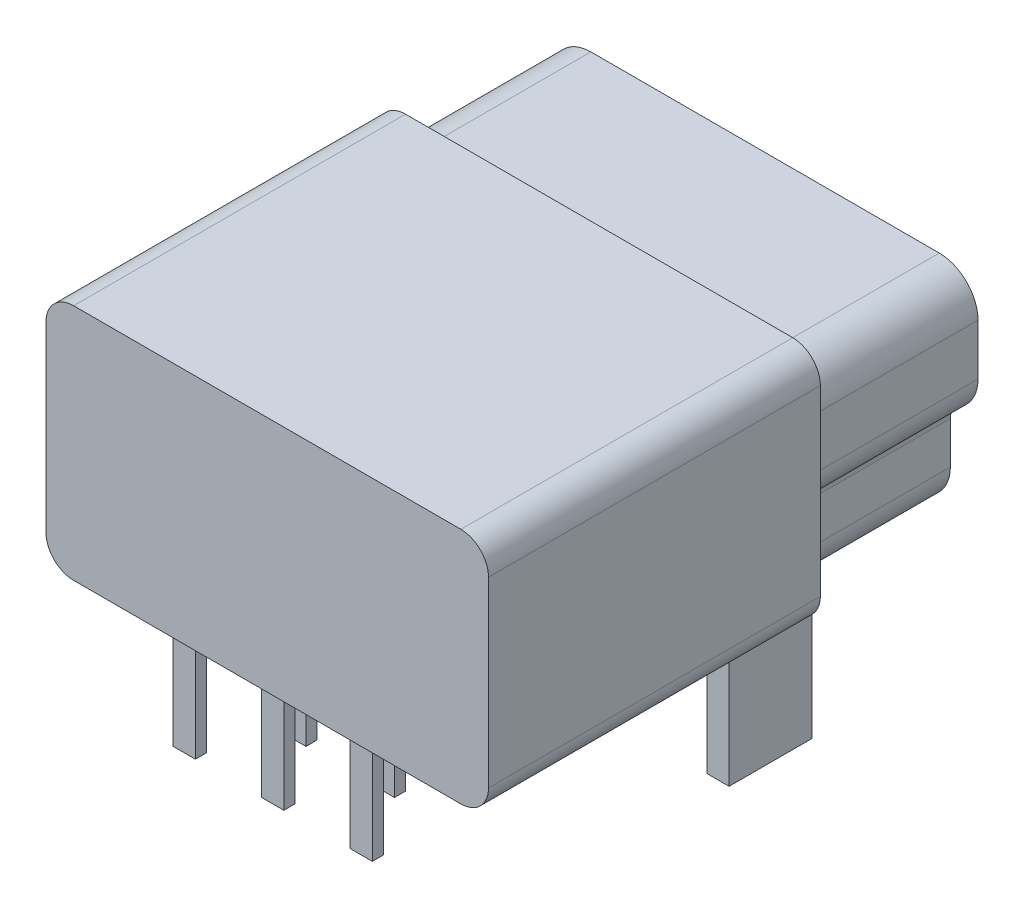
from build123d import *

# Parameters (mm, degrees)
ESQUISSE1_W             = 8
ESQUISSE1_H             = 4.3
EXTRUSION1_DEPTH        = 9
ESQUISSE2_W             = 6
ESQUISSE2_H             = 3.3
ENL_V_MAT_EXTRU_1_DEPTH = 4
ESQUISSE3_W             = 0.4
ESQUISSE3_H             = 1.5
EXTRUSION2_DEPTH        = 1.8
CONG_1_R                = 0.5
ESQUISSE4_W             = 0.4
ESQUISSE4_H             = 0.2
EXTRUSION3_DEPTH        = 1.8
ENL_V_START             = -3
ENL_V_MAT_EXTRU_3_DEPTH = 3


# Read off the part's stored shape, not the designer's step: Enlèv. mat.-Extru.3
with BuildPart() as part:
    # Esquisse1 → Extrusion1 (new body)
    with BuildSketch(Plane.XY):
        with Locations((-4, 2.15)):
            Rectangle(ESQUISSE1_W, ESQUISSE1_H)
    extrude(amount=EXTRUSION1_DEPTH)

    # Esquisse2 → Enlèv. mat.-Extru.1 (cut)
    with BuildSketch(Plane(origin=(0, 0, 0), x_dir=(-1, 0, 0), z_dir=(0, 0, -1))):
        with Locations((4, 2.15)):
            Rectangle(ESQUISSE2_W, ESQUISSE2_H)
    extrude(amount=-ENL_V_MAT_EXTRU_1_DEPTH, mode=Mode.SUBTRACT)

    # Esquisse3 → Extrusion2 (add)
    with BuildSketch(Plane.XZ):
        with Locations((-0.35, 3.75)):
            Rectangle(ESQUISSE3_W, ESQUISSE3_H)
        with Locations((-7.65, 3.75)):
            Rectangle(ESQUISSE3_W, ESQUISSE3_H)
    extrude(amount=EXTRUSION2_DEPTH)

    # Congé1
    # the kernel refuses this fillet: 0.5 mm, written as the material it takes off along each edge
    with BuildSketch(Plane(origin=(0, 0, -1.25), x_dir=(-1, 0, 0), z_dir=(0, 0, 1))) as cong_1_piece_1_section:
        with BuildLine():
            CenterArc((CONG_1_R, -CONG_1_R), CONG_1_R, 90, 90)
            Line((0, -CONG_1_R), (0, 0))
            Line((0, 0), (CONG_1_R, 0))
        make_face()
    cong_1_piece_1 = extrude(amount=11.5, mode=Mode.PRIVATE)
    cong_1_piece_1 = split(cong_1_piece_1, bisect_by=Plane(origin=(-0.251340373, 0.033035409, 3), z_dir=(0, 0, -1)), keep=Keep.TOP, mode=Mode.PRIVATE)
    cong_1_piece_1 = split(cong_1_piece_1, bisect_by=Plane(origin=(-0.15, 0.033035409, 0.875), z_dir=(-1, 0, 0)), keep=Keep.TOP, mode=Mode.PRIVATE)
    add(cong_1_piece_1, mode=Mode.SUBTRACT)
    with BuildSketch(Plane(origin=(0, 0, -1.25), x_dir=(-1, 0, 0), z_dir=(0, 0, 1))) as cong_1_piece_2_section:
        with BuildLine():
            CenterArc((CONG_1_R, -CONG_1_R), CONG_1_R, 90, 90)
            Line((0, -CONG_1_R), (0, 0))
            Line((0, 0), (CONG_1_R, 0))
        make_face()
    cong_1_piece_2 = extrude(amount=11.5, mode=Mode.PRIVATE)
    cong_1_piece_2 = split(cong_1_piece_2, bisect_by=Plane(origin=(-0.054158411, 0.147457064, 3), z_dir=(0, 0, -1)), keep=Keep.TOP, mode=Mode.PRIVATE)
    cong_1_piece_2 = split(cong_1_piece_2, bisect_by=Plane(origin=(-0.15, 0.147457064, 0.875), z_dir=(1, 0, 0)), keep=Keep.TOP, mode=Mode.PRIVATE)
    add(cong_1_piece_2, mode=Mode.SUBTRACT)
    with BuildSketch(Plane(origin=(0, 0, -1.25), x_dir=(-1, 0, 0), z_dir=(0, 0, 1))) as cong_1_piece_3_section:
        with BuildLine():
            CenterArc((CONG_1_R, -CONG_1_R), CONG_1_R, 90, 90)
            Line((0, -CONG_1_R), (0, 0))
            Line((0, 0), (CONG_1_R, 0))
        make_face()
    cong_1_piece_3 = extrude(amount=11.5, mode=Mode.PRIVATE)
    cong_1_piece_3 = split(cong_1_piece_3, bisect_by=Plane(origin=(-0.054158411, 0.147457064, 3), z_dir=(0, 0, 1)), keep=Keep.TOP, mode=Mode.PRIVATE)
    cong_1_piece_3 = split(cong_1_piece_3, bisect_by=Plane(origin=(-0.15, 0.147457064, 3.75), z_dir=(1, 0, 0)), keep=Keep.TOP, mode=Mode.PRIVATE)
    cong_1_piece_3 = split(cong_1_piece_3, bisect_by=Plane(origin=(-0.054158411, 0.147457064, 4.5), z_dir=(0, 0, -1)), keep=Keep.TOP, mode=Mode.PRIVATE)
    add(cong_1_piece_3, mode=Mode.SUBTRACT)
    with BuildSketch(Plane(origin=(0, 0, -1.25), x_dir=(-1, 0, 0), z_dir=(0, 0, 1))) as cong_1_piece_4_section:
        with BuildLine():
            CenterArc((CONG_1_R, -CONG_1_R), CONG_1_R, 90, 90)
            Line((0, -CONG_1_R), (0, 0))
            Line((0, 0), (CONG_1_R, 0))
        make_face()
    cong_1_piece_4 = extrude(amount=11.5, mode=Mode.PRIVATE)
    cong_1_piece_4 = split(cong_1_piece_4, bisect_by=Plane(origin=(-0.15, 0.033035409, 7.375), z_dir=(-1, 0, 0)), keep=Keep.TOP, mode=Mode.PRIVATE)
    cong_1_piece_4 = split(cong_1_piece_4, bisect_by=Plane(origin=(-0.251340373, 0.033035409, 4.5), z_dir=(0, 0, 1)), keep=Keep.TOP, mode=Mode.PRIVATE)
    add(cong_1_piece_4, mode=Mode.SUBTRACT)
    with BuildSketch(Plane(origin=(0, 0, -1.25), x_dir=(-1, 0, 0), z_dir=(0, 0, 1))) as cong_1_piece_5_section:
        with BuildLine():
            CenterArc((CONG_1_R, -CONG_1_R), CONG_1_R, 90, 90)
            Line((0, -CONG_1_R), (0, 0))
            Line((0, 0), (CONG_1_R, 0))
        make_face()
    cong_1_piece_5 = extrude(amount=11.5, mode=Mode.PRIVATE)
    cong_1_piece_5 = split(cong_1_piece_5, bisect_by=Plane(origin=(-0.15, 0.147457064, 7.375), z_dir=(1, 0, 0)), keep=Keep.TOP, mode=Mode.PRIVATE)
    cong_1_piece_5 = split(cong_1_piece_5, bisect_by=Plane(origin=(-0.054158411, 0.147457064, 4.5), z_dir=(0, 0, 1)), keep=Keep.TOP, mode=Mode.PRIVATE)
    add(cong_1_piece_5, mode=Mode.SUBTRACT)
    with BuildSketch(Plane(origin=(-8, 0, -1.25), x_dir=(1, 0, 0), z_dir=(0, 0, 1))) as cong_1_piece_6_section:
        with BuildLine():
            CenterArc((CONG_1_R, CONG_1_R), CONG_1_R, 180, 90)
            Line((0, CONG_1_R), (0, 0))
            Line((0, 0), (CONG_1_R, 0))
        make_face()
    cong_1_piece_6 = extrude(amount=11.5, mode=Mode.PRIVATE)
    cong_1_piece_6 = split(cong_1_piece_6, bisect_by=Plane(origin=(-7.85, 0.033035409, 0.875), z_dir=(1, 0, 0)), keep=Keep.TOP, mode=Mode.PRIVATE)
    cong_1_piece_6 = split(cong_1_piece_6, bisect_by=Plane(origin=(-7.748659627, 0.033035409, 3), z_dir=(0, 0, -1)), keep=Keep.TOP, mode=Mode.PRIVATE)
    add(cong_1_piece_6, mode=Mode.SUBTRACT)
    with BuildSketch(Plane(origin=(-8, 0, -1.25), x_dir=(1, 0, 0), z_dir=(0, 0, 1))) as cong_1_piece_7_section:
        with BuildLine():
            CenterArc((CONG_1_R, CONG_1_R), CONG_1_R, 180, 90)
            Line((0, CONG_1_R), (0, 0))
            Line((0, 0), (CONG_1_R, 0))
        make_face()
    cong_1_piece_7 = extrude(amount=11.5, mode=Mode.PRIVATE)
    cong_1_piece_7 = split(cong_1_piece_7, bisect_by=Plane(origin=(-7.85, 0.147457064, 0.875), z_dir=(-1, 0, 0)), keep=Keep.TOP, mode=Mode.PRIVATE)
    cong_1_piece_7 = split(cong_1_piece_7, bisect_by=Plane(origin=(-7.945841589, 0.147457064, 3), z_dir=(0, 0, -1)), keep=Keep.TOP, mode=Mode.PRIVATE)
    add(cong_1_piece_7, mode=Mode.SUBTRACT)
    with BuildSketch(Plane(origin=(-8, 0, -1.25), x_dir=(1, 0, 0), z_dir=(0, 0, 1))) as cong_1_piece_8_section:
        with BuildLine():
            CenterArc((CONG_1_R, CONG_1_R), CONG_1_R, 180, 90)
            Line((0, CONG_1_R), (0, 0))
            Line((0, 0), (CONG_1_R, 0))
        make_face()
    cong_1_piece_8 = extrude(amount=11.5, mode=Mode.PRIVATE)
    cong_1_piece_8 = split(cong_1_piece_8, bisect_by=Plane(origin=(-7.945841589, 0.147457064, 4.5), z_dir=(0, 0, -1)), keep=Keep.TOP, mode=Mode.PRIVATE)
    cong_1_piece_8 = split(cong_1_piece_8, bisect_by=Plane(origin=(-7.85, 0.147457064, 3.75), z_dir=(-1, 0, 0)), keep=Keep.TOP, mode=Mode.PRIVATE)
    cong_1_piece_8 = split(cong_1_piece_8, bisect_by=Plane(origin=(-7.945841589, 0.147457064, 3), z_dir=(0, 0, 1)), keep=Keep.TOP, mode=Mode.PRIVATE)
    add(cong_1_piece_8, mode=Mode.SUBTRACT)
    with BuildSketch(Plane(origin=(-8, 0, -1.25), x_dir=(1, 0, 0), z_dir=(0, 0, 1))) as cong_1_piece_9_section:
        with BuildLine():
            CenterArc((CONG_1_R, CONG_1_R), CONG_1_R, 180, 90)
            Line((0, CONG_1_R), (0, 0))
            Line((0, 0), (CONG_1_R, 0))
        make_face()
    cong_1_piece_9 = extrude(amount=11.5, mode=Mode.PRIVATE)
    cong_1_piece_9 = split(cong_1_piece_9, bisect_by=Plane(origin=(-7.748659627, 0.033035409, 4.5), z_dir=(0, 0, 1)), keep=Keep.TOP, mode=Mode.PRIVATE)
    cong_1_piece_9 = split(cong_1_piece_9, bisect_by=Plane(origin=(-7.85, 0.033035409, 7.375), z_dir=(1, 0, 0)), keep=Keep.TOP, mode=Mode.PRIVATE)
    add(cong_1_piece_9, mode=Mode.SUBTRACT)
    with BuildSketch(Plane(origin=(-8, 0, -1.25), x_dir=(1, 0, 0), z_dir=(0, 0, 1))) as cong_1_piece_10_section:
        with BuildLine():
            CenterArc((CONG_1_R, CONG_1_R), CONG_1_R, 180, 90)
            Line((0, CONG_1_R), (0, 0))
            Line((0, 0), (CONG_1_R, 0))
        make_face()
    cong_1_piece_10 = extrude(amount=11.5, mode=Mode.PRIVATE)
    cong_1_piece_10 = split(cong_1_piece_10, bisect_by=Plane(origin=(-7.945841589, 0.147457064, 4.5), z_dir=(0, 0, 1)), keep=Keep.TOP, mode=Mode.PRIVATE)
    cong_1_piece_10 = split(cong_1_piece_10, bisect_by=Plane(origin=(-7.85, 0.147457064, 7.375), z_dir=(-1, 0, 0)), keep=Keep.TOP, mode=Mode.PRIVATE)
    add(cong_1_piece_10, mode=Mode.SUBTRACT)
    with BuildSketch(Plane(origin=(-8, 4.3, -1.25), x_dir=(0, -1, 0), z_dir=(0, 0, 1))) as cong_1_piece_11:
        with BuildLine():
            CenterArc((CONG_1_R, CONG_1_R), CONG_1_R, 180, 90)
            Line((0, CONG_1_R), (0, 0))
            Line((0, 0), (CONG_1_R, 0))
        make_face()
    extrude(amount=11.5, mode=Mode.SUBTRACT)
    with BuildSketch(Plane(origin=(0, 4.3, -1.25), x_dir=(0, -1, 0), z_dir=(0, 0, 1))) as cong_1_piece_12:
        with BuildLine():
            CenterArc((CONG_1_R, -CONG_1_R), CONG_1_R, 90, 90)
            Line((0, -CONG_1_R), (0, 0))
            Line((0, 0), (CONG_1_R, 0))
        make_face()
    extrude(amount=11.5, mode=Mode.SUBTRACT)

    # Esquisse4 → Extrusion3 (add)
    with BuildSketch(Plane.XZ):
        with Locations((-2.4, 8.8)):
            Rectangle(ESQUISSE4_W, ESQUISSE4_H)
        with Locations((-5.6, 8.8)):
            Rectangle(ESQUISSE4_W, ESQUISSE4_H)
        with Locations((-4, 8.8)):
            Rectangle(ESQUISSE4_W, ESQUISSE4_H)
        with Locations((-3.2, 7.6)):
            Rectangle(ESQUISSE4_W, ESQUISSE4_H)
        with Locations((-4.8, 7.6)):
            Rectangle(ESQUISSE4_W, ESQUISSE4_H)
    extrude(amount=EXTRUSION3_DEPTH)

    # Enlèv. mat.-Extru.3 outline → Enlèv. mat.-Extru.3 (cut)
    with BuildSketch(Plane(origin=(0, 0, 0), x_dir=(-1, 0, 0), z_dir=(0, 0, -1)).offset(ENL_V_START)):
        with BuildLine():
            Line((0.15, 2.326025404), (0.15, 3.25))
            ThreePointArc((0.15, 3.25), (0.355025253, 3.744974747), (0.85, 3.95))
            Line((0.85, 3.95), (7.15, 3.95))
            ThreePointArc((7.15, 3.95), (7.644974747, 3.744974747), (7.85, 3.25))
            Line((7.85, 3.25), (7.85, 2.326025404))
            ThreePointArc((7.85, 2.326025404), (7.756217783, 1.976025404), (7.5, 1.719807621))
            ThreePointArc((7.5, 1.719807621), (7.390192379, 1.61), (7.35, 1.46))
            Line((7.35, 1.46), (7.35, 0.7))
            ThreePointArc((7.35, 0.7), (7.144974747, 0.205025253), (6.65, 0))
            Line((6.65, 0), (7.5, 0))
            ThreePointArc((7.5, 0), (7.853553391, 0.146446609), (8, 0.5))
            Line((8, 0.5), (8, 3.8))
            ThreePointArc((8, 3.8), (7.853553391, 4.153553391), (7.5, 4.3))
            Line((7.5, 4.3), (0.5, 4.3))
            ThreePointArc((0.5, 4.3), (0.146446609, 4.153553391), (0, 3.8))
            Line((0, 3.8), (0, 0.5))
            ThreePointArc((0, 0.5), (0.146446609, 0.146446609), (0.5, 0))
            Line((0.5, 0), (1.35, 0))
            ThreePointArc((1.35, 0), (0.855025253, 0.205025253), (0.65, 0.7))
            Line((0.65, 0.7), (0.65, 1.46))
            ThreePointArc((0.65, 1.46), (0.609807621, 1.61), (0.5, 1.719807621))
            ThreePointArc((0.5, 1.719807621), (0.243782217, 1.976025404), (0.15, 2.326025404))
        make_face()
    extrude(amount=ENL_V_MAT_EXTRU_3_DEPTH, mode=Mode.SUBTRACT)


solid = part.part
